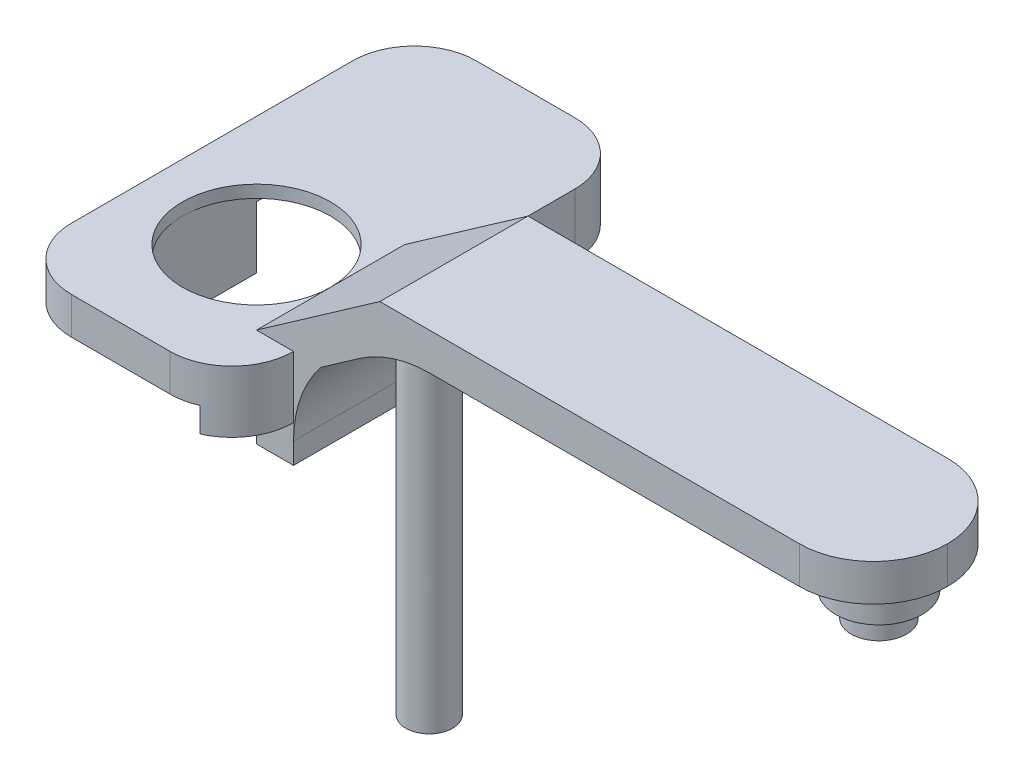
from build123d import *

# Parameters (mm, degrees)
SKETCH1_W            = 40
SKETCH1_H            = 12
BOSS_EXTRUDE1_DEPTH  = 3
SKETCH1_7_R          = 3.5
BOSS_EXTRUDE2_DEPTH  = 3
BOSS_EXTRUDE4_DEPTH  = 12
SKETCH4_W            = 3
SKETCH4_H            = 12
BOSS_EXTRUDE5_DEPTH  = 5
FILLET3_R            = 10
BOSS_EXTRUDE11_START = -27.8
BOSS_EXTRUDE11_DEPTH = 32.8
CUT_EXTRUDE2_DEPTH   = 47.899705007
FILLET7_R            = 6
BOSS_EXTRUDE12_DEPTH = 5
CUT_EXTRUDE3_START   = -2
CUT_EXTRUDE3_DEPTH   = 2
SKETCH13_W           = 3
SKETCH13_H           = 12
BOSS_EXTRUDE13_DEPTH = 5
SKETCH13_3_W         = 5
SKETCH13_3_H         = 4.8
BOSS_EXTRUDE14_DEPTH = 14
SKETCH14_R           = 1
CUT_EXTRUDE4_DEPTH   = 10
FILLET8_R            = 10
FILLET9_R            = 5
SKETCH15_R           = 1.9
SKETCH15_R_2         = 1
BOSS_EXTRUDE15_DEPTH = 30
SKETCH15_2_R         = 1
BOSS_EXTRUDE16_DEPTH = 20


# Read off the part's stored shape, not the designer's step: Boss-Extrude11, Cut-Extrude3
# Some blends are built 0.0001 mm under size
with BuildPart() as part:
    # Sketch1 → Boss-Extrude1 (new body)
    with BuildSketch(Plane(origin=(0, 0, 0), x_dir=(1, 0, 0), z_dir=(0, 1, 0))):
        with Locations((20.375241408, -0.133846421)):
            Rectangle(SKETCH1_W, SKETCH1_H)
    extrude(amount=BOSS_EXTRUDE1_DEPTH)

    # Sketch1<7> → Boss-Extrude2 (add)
    with BuildSketch(Plane(origin=(0, 0, 0), x_dir=(1, 0, 0), z_dir=(0, 1, 0))):
        with Locations(Location((34.817424324, -0.133846421, 0), (0, 0, 270))):
            Circle(SKETCH1_7_R)
    extrude(amount=-BOSS_EXTRUDE2_DEPTH)

    # Sketch3 → Boss-Extrude4 (add)
    with BuildSketch(Plane.XY.offset(6.133846421)):
        Polygon((0.375241408, 3), (-9.624758592, -4), (-4.393377613, -4), (5.606622387, 3), align=None)
    extrude(amount=-BOSS_EXTRUDE4_DEPTH)

    # Sketch4 → Boss-Extrude5 (add)
    with BuildSketch(Plane(origin=(0, -4, 0), x_dir=(-1, 0, 0), z_dir=(0, -1, 0))):
        with Locations((8.124758592, -0.133846421)):
            Rectangle(SKETCH4_W, SKETCH4_H)
    extrude(amount=BOSS_EXTRUDE5_DEPTH)

    # Fillet3
    fillet3_edges = [part.edges().sort_by_distance(p)[0] for p in [
        (1.320908101, 0, 0.133846421),
    ]]
    fillet(fillet3_edges, radius=FILLET3_R)

    # Boss-Extrude11 outline → Boss-Extrude11 (add)
    with BuildSketch(Plane.XY.offset(6.133846421).offset(BOSS_EXTRUDE11_START)):
        Polygon((-9.624758592, -7), (-9.624758592, -9), (-6.624758592, -9), (-6.624758592, -4), (-24.624758592, -4), (-24.624758592, -7), align=None)
    extrude(amount=BOSS_EXTRUDE11_DEPTH)

    # Sketch12 → Cut-Extrude2 (cut, through all)
    with BuildSketch(Plane(origin=(0, -7, 0), x_dir=(-1, 0, 0), z_dir=(0, -1, 0))):
        with BuildLine():
            ThreePointArc((9.624758592, -0.133846421), (11.382117904, -4.376487108), (15.624758592, -6.133846421))
            Line((15.624758592, -6.133846421), (15.624758592, 5.866153579))
            ThreePointArc((15.624758592, 5.866153579), (11.382117904, 4.108794266), (9.624758592, -0.133846421))
        make_face()
        with BuildLine():
            Line((15.624758592, 5.866153579), (15.624758592, -6.133846421))
            ThreePointArc((15.624758592, -6.133846421), (19.867399279, -4.376487108), (21.624758592, -0.133846421))
            ThreePointArc((21.624758592, -0.133846421), (19.867399279, 4.108794266), (15.624758592, 5.866153579))
        make_face()
    extrude(amount=-CUT_EXTRUDE2_DEPTH, mode=Mode.SUBTRACT)

    # Fillet7
    fillet7_edges = [part.edges().sort_by_distance(p)[0] for p in [
        (40.375241408, 1.5, -5.866153579),
        (40.375241408, 1.5, 6.133846421),
    ]]
    fillet(fillet7_edges, radius=FILLET7_R - 0.0001)  # a hair under: the kernel refuses the full size

    # Sketch1<9> → Boss-Extrude12 (add)
    with BuildSketch(Plane(origin=(0, 0, 0), x_dir=(1, 0, 0), z_dir=(0, 1, 0))):
        with BuildLine():
            ThreePointArc((32.567424324, -0.133846421), (34.817424324, -2.383846421), (37.067424324, -0.133846421))
            Line((37.067424324, -0.133846421), (32.567424324, -0.133846421))
        make_face()
        with BuildLine():
            Line((32.567424324, -0.133846421), (37.067424324, -0.133846421))
            ThreePointArc((37.067424324, -0.133846421), (34.817424324, 2.116153579), (32.567424324, -0.133846421))
        make_face()
    extrude(amount=-BOSS_EXTRUDE12_DEPTH)

    # Cut-Extrude3 outline → Cut-Extrude3 (cut)
    with BuildSketch(Plane(origin=(0, -7, 0), x_dir=(-1, 0, 0), z_dir=(0, -1, 0)).offset(CUT_EXTRUDE3_START)):
        with BuildLine():
            Line((21.624758592, 16.866153579), (9.624758592, 16.866153579))
            Line((9.624758592, 16.866153579), (9.624758592, -0.133846426))
            ThreePointArc((9.624758592, -0.133846426), (15.624758589, 5.866153579), (21.624758592, -0.133846421))
            Line((21.624758592, -0.133846421), (21.624758592, 16.866153579))
        make_face()
        with BuildLine():
            ThreePointArc((15.624758592, -6.133846421), (11.382117907, -4.37648711), (9.624758592, -0.133846426))
            Line((9.624758592, -0.133846426), (9.624758592, -6.133846421))
            Line((9.624758592, -6.133846421), (15.624758592, -6.133846421))
        make_face()
        with BuildLine():
            Line((21.624758592, -6.133846421), (21.624758592, -0.133846421))
            ThreePointArc((21.624758592, -0.133846421), (19.867399279, -4.376487108), (15.624758592, -6.133846421))
            Line((15.624758592, -6.133846421), (21.624758592, -6.133846421))
        make_face()
    extrude(amount=CUT_EXTRUDE3_DEPTH, mode=Mode.SUBTRACT)

    # Sketch13 → Boss-Extrude13 (add)
    with BuildSketch(Plane(origin=(0, -7, 0), x_dir=(-1, 0, 0), z_dir=(0, -1, 0))):
        with Locations((8.124758592, -0.133846421)):
            Rectangle(SKETCH13_W, SKETCH13_H)
        with Locations((23.124758592, -0.133846421)):
            Rectangle(SKETCH13_W, SKETCH13_H)
    extrude(amount=BOSS_EXTRUDE13_DEPTH)

    # Sketch13<3> → Boss-Extrude14 (add)
    with BuildSketch(Plane(origin=(0, -7, 0), x_dir=(-1, 0, 0), z_dir=(0, -1, 0))):
        with Locations((15.624758592, 19.266153579)):
            Rectangle(SKETCH13_3_W, SKETCH13_3_H)
    extrude(amount=BOSS_EXTRUDE14_DEPTH)

    # Sketch14 → Cut-Extrude4 (cut)
    with BuildSketch(Plane.XZ.offset(21)):
        with Locations((-15.624758592, -18.866153579)):
            Circle(SKETCH14_R)
        with Locations((-15.624758592, 8.133846421)):
            Circle(SKETCH14_R)
    extrude(amount=-CUT_EXTRUDE4_DEPTH, mode=Mode.SUBTRACT)

    # Fillet8
    # the kernel refuses this fillet: 10 mm, written as the material it adds along each edge
    with BuildSketch(Plane(origin=(-6.624758592, -4, -5.866153579), x_dir=(1, 0, 0), z_dir=(0, 0, 1))) as fillet8_piece_1:
        with BuildLine():
            CenterArc((10, -6.296710133), FILLET8_R, 140.974145336, 39.025854664)
            Line((0, -6.296710133), (0, 0))
            Line((0, 0), (2.231380978, 0))
        make_face()
    extrude(amount=12)

    # Fillet9
    fillet9_edges = [part.edges().sort_by_distance(p)[0] for p in [
        (-24.624758592, -5.5, -21.666153579),
        (-6.624758592, -6.5, -21.666153579),
        (-6.624758592, -6.5, 11.133846421),
        (-24.624758592, -5.5, 11.133846421),
    ]]
    fillet(fillet9_edges, radius=FILLET9_R - 0.0001)  # a hair under: the kernel refuses the full size

    # Sketch15 → Boss-Extrude15 (add)
    with BuildSketch(Plane(origin=(0, 0, 0), x_dir=(-1, 0, 0), z_dir=(0, -1, 0))):
        with Locations(Location((1.624758592, -0.133846421, 0), (0, 0, 258.977606014))):
            Circle(SKETCH15_R)
        with Locations(Location((1.624758592, -0.133846421, 0), (0, 0, 248.699103744))):
            Circle(SKETCH15_R_2, mode=Mode.SUBTRACT)
    extrude(amount=BOSS_EXTRUDE15_DEPTH)

    # Sketch15<2> → Boss-Extrude16 (add)
    with BuildSketch(Plane(origin=(0, 0, 0), x_dir=(-1, 0, 0), z_dir=(0, -1, 0))):
        with Locations(Location((1.624758592, -0.133846421, 0), (0, 0, 90))):
            Circle(SKETCH15_2_R)
    extrude(amount=BOSS_EXTRUDE16_DEPTH)


solid = part.part
